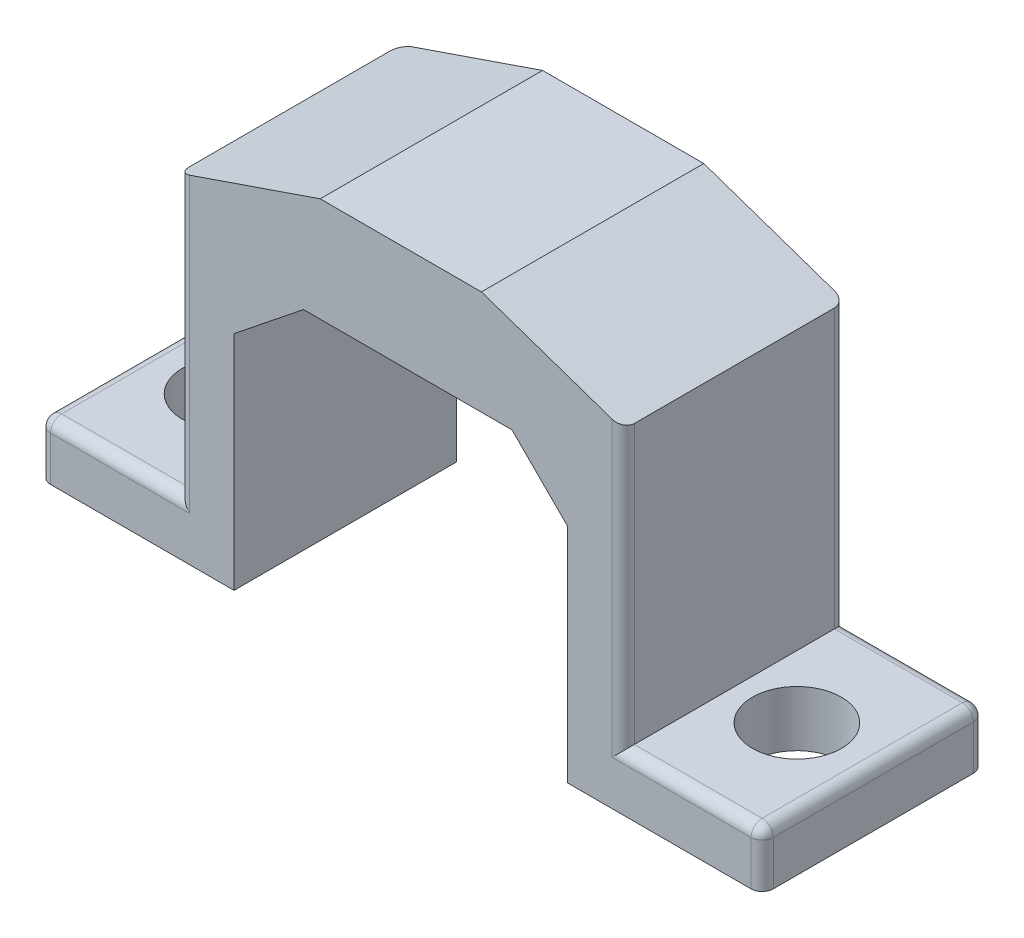
from build123d import *

# Parameters (mm, degrees)
GRUNDK_RPER_DEPTH              = 8
SKIZZE4_R                      = 1.6
SCHRAUBEN_BOHRUNG_DEPTH        = 3
VERRUNDUNG1_R                  = 0.4
DREIECKE_SEITLICH_HALTER_DEPTH = 0.75


with BuildPart() as part:
    # Skizze1 → Grundkörper (new body)
    with BuildSketch(Plane.XY):
        Polygon((0, 0), (7, 0), (7, 10), (19, 10), (19, 0), (26, 0), (26, 2), (21, 2), (21, 12), (15.9, 13.75), (10.1, 13.75), (5, 12), (5, 2), (0, 2), align=None)
    extrude(amount=GRUNDK_RPER_DEPTH)

    # Skizze4 → Schrauben-Bohrung (cut)
    with BuildSketch(Plane.XZ):
        with Locations((23.25, 4)):
            Circle(SKIZZE4_R)
    schrauben_bohrung = extrude(amount=-SCHRAUBEN_BOHRUNG_DEPTH, mode=Mode.SUBTRACT)

    # Verrundung1
    verrundung1_edges = [part.edges().sort_by_distance(p)[0] for p in [
        (23.5, 2, 0),
        (23.5, 2, 8),
        (2.5, 2, 0),
        (2.5, 2, 8),
        (5, 7, 8),
        (5, 7, 0),
        (21, 7, 8),
        (21, 7, 0),
        (26, 1, 0),
        (26, 1, 8),
        (26, 2, 4),
        (0, 2, 4),
        (0, 1, 8),
    ]]
    fillet(verrundung1_edges, radius=VERRUNDUNG1_R)

    # Skizze8 → Dreiecke_seitlich_Halter (add)
    with BuildSketch(Plane.XY.offset(8)):
        Polygon((9.5, 10), (7, 8), (7, 10), align=None)
        Polygon((17, 10), (19, 10), (19, 8), align=None)
    dreiecke_seitlich_halter = extrude(amount=-DREIECKE_SEITLICH_HALTER_DEPTH)

    # Spiegeln_seitlich_Halter: Dreiecke_seitlich_Halter across plane
    add(dreiecke_seitlich_halter.mirror(Plane.XY.offset(5)))

    # Spiegeln5: Schrauben-Bohrung across plane
    add(schrauben_bohrung.mirror(Plane(origin=(13, 0, 0), x_dir=(0, 0, 1), z_dir=(1, 0, 0))), mode=Mode.SUBTRACT)


solid = part.part
